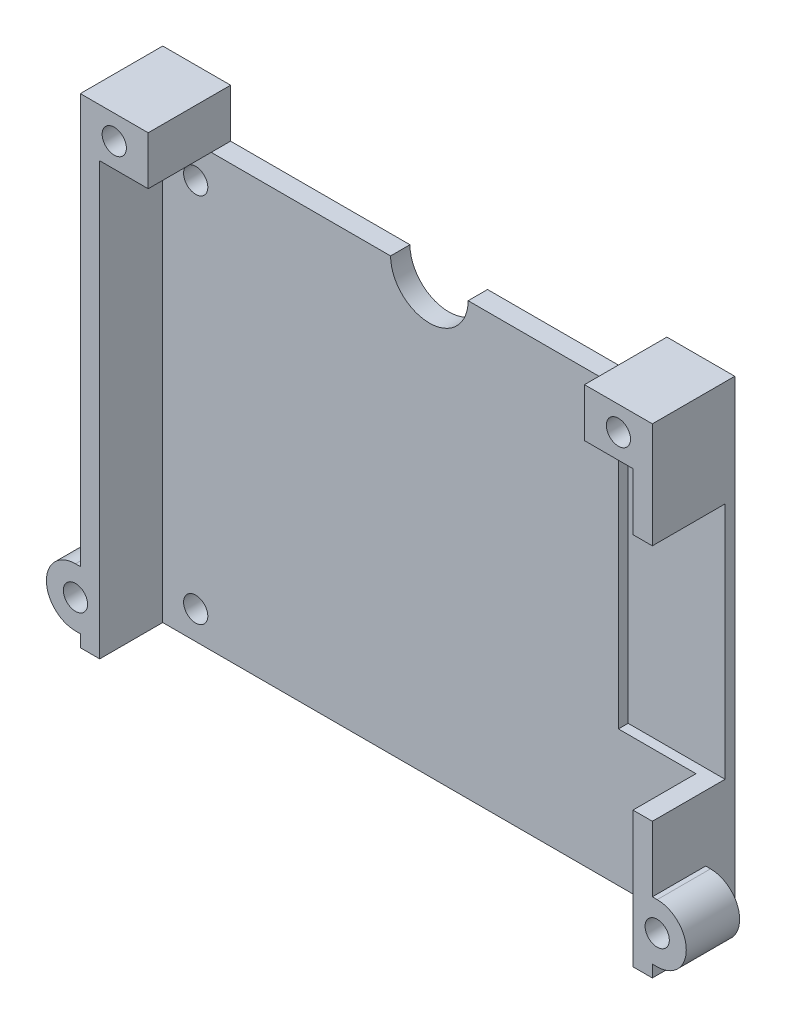
from build123d import *

# Parameters (mm, degrees)
BOSS_EXTRUDE1_DEPTH = 44.5
SKETCH2_W           = 7.5
SKETCH2_H           = 24.6
CUT_EXTRUDE1_DEPTH  = 10
BOSS_EXTRUDE2_DEPTH = 8.5
CUT_EXTRUDE2_DEPTH  = 11
SKETCH4_W           = 7
SKETCH4_H           = 8.5
BOSS_EXTRUDE3_DEPTH = 5
SKETCH5_R           = 1.25
CUT_EXTRUDE3_DEPTH  = 81.179486155
SKETCH7_R           = 1.25
CUT_EXTRUDE4_DEPTH  = 10
SKETCH8_R           = 4
CUT_EXTRUDE5_DEPTH  = 81.179486155
CUT_EXTRUDE6_DEPTH  = 3
BOSS_EXTRUDE4_DEPTH = 3


with BuildPart() as part:
    # Sketch1 → Boss-Extrude1 (new body)
    with BuildSketch(Plane(origin=(0, 0, 0), x_dir=(1, 0, 0), z_dir=(0, 1, 0))):
        Polygon((0, 0), (2, 0), (2, 6.5), (57, 6.5), (57, 0), (59, 0), (59, 8.5), (0, 8.5), align=None)
    extrude(amount=BOSS_EXTRUDE1_DEPTH)

    # Sketch2 → Cut-Extrude1 (cut)
    with BuildSketch(Plane(origin=(59, 0, 0), x_dir=(0, 0, -1), z_dir=(1, 0, 0))):
        with Locations((3.75, 26.3)):
            Rectangle(SKETCH2_W, SKETCH2_H)
    extrude(amount=-CUT_EXTRUDE1_DEPTH, mode=Mode.SUBTRACT)

    # Sketch3 → Boss-Extrude2 (add)
    with BuildSketch(Plane(origin=(0, 0, -8.5), x_dir=(-1, 0, 0), z_dir=(0, 0, -1))):
        with BuildLine():
            Line((-59, 5.395643924), (-59, 7.25))
            Line((-59, 7.25), (-59.5, 7.25))
            ThreePointArc((-59.5, 7.25), (-62.5, 4.25), (-59.5, 1.25))
            Line((-59.5, 1.25), (-59, 1.25))
            Line((-59, 1.25), (-59, 3.104356076))
            ThreePointArc((-59, 3.104356076), (-60.75, 4.25), (-59, 5.395643924))
        make_face()
        with BuildLine():
            Line((0.5, 7.25), (0, 7.25))
            Line((0, 7.25), (0, 5.395643924))
            ThreePointArc((0, 5.395643924), (1.75, 4.25), (0, 3.104356076))
            Line((0, 3.104356076), (0, 1.25))
            Line((0, 1.25), (0.5, 1.25))
            ThreePointArc((0.5, 1.25), (3.5, 4.25), (0.5, 7.25))
        make_face()
    extrude(amount=-BOSS_EXTRUDE2_DEPTH)

    # Sketch3<3> → Cut-Extrude2 (cut)
    with BuildSketch(Plane(origin=(0, 0, -8.5), x_dir=(-1, 0, 0), z_dir=(0, 0, -1))):
        with BuildLine():
            ThreePointArc((-59, 3.104356076), (-58.25, 4.25), (-59, 5.395643924))
            Line((-59, 5.395643924), (-59, 3.104356076))
        make_face()
        with BuildLine():
            Line((0, 3.104356076), (0, 5.395643924))
            ThreePointArc((0, 5.395643924), (-0.75, 4.25), (0, 3.104356076))
        make_face()
    extrude(amount=-CUT_EXTRUDE2_DEPTH, mode=Mode.SUBTRACT)

    # Sketch4 → Boss-Extrude3 (add)
    with BuildSketch(Plane(origin=(0, 44.5, 0), x_dir=(1, 0, 0), z_dir=(0, 1, 0))):
        with Locations((3.5, 4.25)):
            Rectangle(SKETCH4_W, SKETCH4_H)
        with Locations((55.5, 4.25)):
            Rectangle(SKETCH4_W, SKETCH4_H)
    extrude(amount=BOSS_EXTRUDE3_DEPTH)

    # Sketch5 → Cut-Extrude3 (cut, through all)
    with BuildSketch(Plane(origin=(0, 0, -8.5), x_dir=(-1, 0, 0), z_dir=(0, 0, -1))):
        with Locations((-55.5, 47)):
            Circle(SKETCH5_R)
        with Locations((-3.5, 47)):
            Circle(SKETCH5_R)
    extrude(amount=-CUT_EXTRUDE3_DEPTH, mode=Mode.SUBTRACT)

    # Sketch7 → Cut-Extrude4 (cut)
    with BuildSketch(Plane(origin=(0, 0, -8.5), x_dir=(-1, 0, 0), z_dir=(0, 0, -1))):
        with Locations((-5.4, 2.9)):
            Circle(SKETCH7_R)
        with Locations((-53.6, 2.9)):
            Circle(SKETCH7_R)
        with Locations((-53.6, 41.2)):
            Circle(SKETCH7_R)
        with Locations((-5.4, 41.2)):
            Circle(SKETCH7_R)
    extrude(amount=-CUT_EXTRUDE4_DEPTH, mode=Mode.SUBTRACT)

    # Sketch8 → Cut-Extrude5 (cut, through all)
    with BuildSketch(Plane(origin=(0, 0, -8.5), x_dir=(-1, 0, 0), z_dir=(0, 0, -1))):
        with Locations((-29.5, 44.5)):
            Circle(SKETCH8_R)
    extrude(amount=-CUT_EXTRUDE5_DEPTH, mode=Mode.SUBTRACT)

    # Sketch3<4> → Cut-Extrude6 (cut)
    with BuildSketch(Plane(origin=(0, 0, -8.5), x_dir=(-1, 0, 0), z_dir=(0, 0, -1))):
        with BuildLine():
            Line((-59, 5.395643924), (-59, 7.25))
            Line((-59, 7.25), (-59.5, 7.25))
            ThreePointArc((-59.5, 7.25), (-62.5, 4.25), (-59.5, 1.25))
            Line((-59.5, 1.25), (-59, 1.25))
            Line((-59, 1.25), (-59, 3.104356076))
            ThreePointArc((-59, 3.104356076), (-60.75, 4.25), (-59, 5.395643924))
        make_face()
        with BuildLine():
            Line((0.5, 7.25), (0, 7.25))
            Line((0, 7.25), (0, 5.395643924))
            ThreePointArc((0, 5.395643924), (1.75, 4.25), (0, 3.104356076))
            Line((0, 3.104356076), (0, 1.25))
            Line((0, 1.25), (0.5, 1.25))
            ThreePointArc((0.5, 1.25), (3.5, 4.25), (0.5, 7.25))
        make_face()
    extrude(amount=-CUT_EXTRUDE6_DEPTH, mode=Mode.SUBTRACT)

    # Sketch3<5> → Boss-Extrude4 (add)
    with BuildSketch(Plane(origin=(0, 0, -8.5), x_dir=(-1, 0, 0), z_dir=(0, 0, -1))):
        with BuildLine():
            ThreePointArc((-59, 3.104356076), (-58.25, 4.25), (-59, 5.395643924))
            Line((-59, 5.395643924), (-59, 3.104356076))
        make_face()
        with BuildLine():
            Line((0, 3.104356076), (0, 5.395643924))
            ThreePointArc((0, 5.395643924), (-0.75, 4.25), (0, 3.104356076))
        make_face()
    extrude(amount=-BOSS_EXTRUDE4_DEPTH)


solid = part.part
